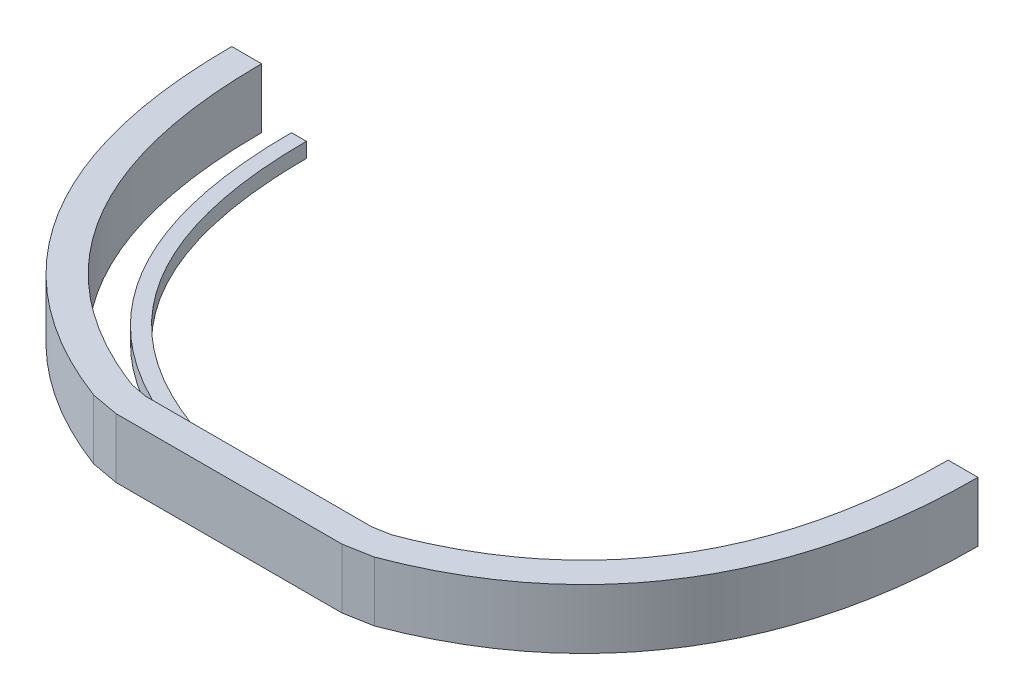
from build123d import *

# Parameters (mm, degrees)
BOSS_EXTRUDE1_DEPTH      = 20
BOSS_EXTRUDE1_DEPTH_BACK = 0.0001
BOSS_EXTRUDE4_DEPTH      = 5


with BuildPart() as part:
    # Sketch4 → Boss-Extrude1 (new, two sides: drawn at the far end of the back side and taken through both)
    with BuildSketch(Plane(origin=(0, 0, -270), x_dir=(-1, 0, 0), z_dir=(0, 1, 0)).offset(-BOSS_EXTRUDE1_DEPTH_BACK)):
        with BuildLine():
            Line((214.999999999, 169.104288462), (224.999999998, 169.104426842))
            add(Edge.make_bspline(
                [(224.999999998, 169.104426842), (224.999974919, 170.916710511), (224.954558622, 174.559843352), (224.679415125, 181.694134696), (223.984242287, 190.432612696), (222.567585315, 200.599347711), (219.872146823, 213.732896531), (214.930493855, 229.327021495), (206.321779618, 246.520686701), (195.001697467, 261.848184611), (183.462412341, 272.756450732), (173.138723517, 280.255372373), (164.896207239, 285.260831915), (157.640364085, 288.920961058), (151.627903078, 291.546243443), (148.540096269, 292.764883121), (146.990873849, 293.345633455)],
                knots=[0.497169382, 0.497169382, 0.497169382, 0.497169382, 0.497311211, 0.497453039, 0.497736697, 0.498020354, 0.498304011, 0.498871326, 0.499438641, 0.500005956, 0.500573271, 0.500856928, 0.501140585, 0.501424243, 0.501566072, 0.5017079, 0.5017079, 0.5017079, 0.5017079], degree=3))
            Line((146.990873849, 293.345633455), (137.864531116, 295))
            Line((137.864531116, 295), (62.135468884, 295))
            Line((62.135468884, 295), (53.009126151, 293.345633455))
            add(Edge.make_bspline(
                [(-24.999999998, 169.104426842), (-24.999974919, 170.916710511), (-24.954558622, 174.559843352), (-24.679415125, 181.694134696), (-23.984242287, 190.432612696), (-22.567585315, 200.599347711), (-19.872146823, 213.732896532), (-14.930493855, 229.327021495), (-6.321779618, 246.520686701), (4.998302533, 261.848184611), (16.537587659, 272.756450732), (26.861276483, 280.255372373), (35.103792761, 285.260831915), (42.359635915, 288.920961058), (48.372096922, 291.546243443), (51.459903731, 292.764883121), (53.009126151, 293.345633455)],
                knots=[0.497169382, 0.497169382, 0.497169382, 0.497169382, 0.497311211, 0.497453039, 0.497736697, 0.498020354, 0.498304011, 0.498871326, 0.499438641, 0.500005956, 0.500573271, 0.500856928, 0.501140585, 0.501424243, 0.501566072, 0.5017079, 0.5017079, 0.5017079, 0.5017079], degree=3))
            Line((-24.999999998, 169.104426842), (-14.999999999, 169.104288463))
            add(Edge.make_bspline(
                [(-14.999999999, 169.104288463), (-14.999976092, 170.831876653), (-14.956619117, 174.308325029), (-14.694962406, 181.087759886), (-14.036476763, 189.356701351), (-12.703754537, 198.913675954), (-10.18542805, 211.177227162), (-5.611430736, 225.58666158), (2.256873954, 241.285209093), (12.524312246, 255.182625466), (22.98750085, 265.077162111), (32.399784152, 271.915566951), (39.951269813, 276.502541648), (46.639369527, 279.877182217), (52.20644523, 282.308299711), (55.079506444, 283.442214827), (56.519257971, 283.98192828)],
                knots=[0.497169382, 0.497169382, 0.497169382, 0.497169382, 0.497311211, 0.497453039, 0.497736697, 0.498020354, 0.498304011, 0.498871326, 0.499438641, 0.500005956, 0.500573271, 0.500856928, 0.501140585, 0.501424243, 0.501566072, 0.5017079, 0.5017079, 0.5017079, 0.5017079], degree=3))
            Line((56.519257971, 283.98192828), (62.135468884, 285))
            Line((62.135468884, 285), (137.864531116, 285))
            Line((137.864531116, 285), (143.480742029, 283.98192828))
            add(Edge.make_bspline(
                [(214.999999999, 169.104288462), (214.999976092, 170.831876653), (214.956619117, 174.308325029), (214.694962406, 181.087759886), (214.036476763, 189.356701351), (212.703754537, 198.913675954), (210.18542805, 211.177227162), (205.611430736, 225.58666158), (197.743126046, 241.285209093), (187.475687754, 255.182625466), (177.01249915, 265.077162111), (167.600215848, 271.915566951), (160.048730187, 276.502541648), (153.360630473, 279.877182217), (147.79355477, 282.308299711), (144.920493556, 283.442214827), (143.480742029, 283.98192828)],
                knots=[0.497169382, 0.497169382, 0.497169382, 0.497169382, 0.497311211, 0.497453039, 0.497736697, 0.498020354, 0.498304011, 0.498871326, 0.499438641, 0.500005956, 0.500573271, 0.500856928, 0.501140585, 0.501424243, 0.501566072, 0.5017079, 0.5017079, 0.5017079, 0.5017079], degree=3))
        make_face()
    extrude(amount=BOSS_EXTRUDE1_DEPTH + BOSS_EXTRUDE1_DEPTH_BACK)


with BuildPart() as body_2:
    # Sketch4<11> → Boss-Extrude4 (new body)
    with BuildSketch(Plane(origin=(0, 0, -270), x_dir=(-1, 0, 0), z_dir=(0, 1, 0))):
        with BuildLine():
            Line((139.970610208, 274.618223105), (137.864531116, 275))
            Line((137.864531116, 275), (62.135468884, 275))
            Line((62.135468884, 275), (60.029389792, 274.618223105))
            add(Edge.make_bspline(
                [(-4.999999999, 169.104150083), (-4.999977265, 170.747042795), (-4.958679611, 174.056806706), (-4.710509687, 180.481385077), (-4.08871124, 188.280790006), (-2.83992376, 197.228004196), (-0.498709277, 208.621557793), (3.707632382, 221.846301666), (10.835527526, 236.049731485), (20.050321959, 248.517066321), (29.437414042, 257.39787349), (37.938291821, 263.575761528), (44.798746865, 267.74425138), (50.919103139, 270.833403376), (56.040793539, 273.07035598), (58.699109157, 274.119546534), (60.029389792, 274.618223105)],
                knots=[0.497169382, 0.497169382, 0.497169382, 0.497169382, 0.497311211, 0.497453039, 0.497736697, 0.498020354, 0.498304011, 0.498871326, 0.499438641, 0.500005956, 0.500573271, 0.500856928, 0.501140585, 0.501424243, 0.501566072, 0.5017079, 0.5017079, 0.5017079, 0.5017079], degree=3))
            Line((-4.999999999, 169.104150083), (0, 169.104080894))
            add(Edge.make_bspline(
                [(0, 169.104080894), (0.001074817, 246.775900688), (61.784455702, 269.936370518)],
                knots=[0, 0, 0, 1, 1, 1], degree=2))
            Line((61.784455702, 269.936370518), (62.135468884, 270))
            Line((62.135468884, 270), (137.864531116, 270))
            Line((137.864531116, 270), (138.215544298, 269.936370518))
            add(Edge.make_bspline(
                [(200, 169.104080894), (199.998925183, 246.775900688), (138.215544298, 269.936370518)],
                knots=[0, 0, 0, 1, 1, 1], degree=2))
            Line((200, 169.104080894), (205, 169.104150083))
            add(Edge.make_bspline(
                [(205, 169.104150083), (204.999977265, 170.747042795), (204.958679611, 174.056806706), (204.710509687, 180.481385077), (204.08871124, 188.280790006), (202.83992376, 197.228004196), (200.498709277, 208.621557793), (196.292367618, 221.846301666), (189.164472474, 236.049731485), (179.949678041, 248.517066321), (170.562585958, 257.39787349), (162.061708179, 263.575761528), (155.201253135, 267.74425138), (149.080896861, 270.833403376), (143.959206461, 273.07035598), (141.300890843, 274.119546534), (139.970610208, 274.618223105)],
                knots=[0.497169382, 0.497169382, 0.497169382, 0.497169382, 0.497311211, 0.497453039, 0.497736697, 0.498020354, 0.498304011, 0.498871326, 0.499438641, 0.500005956, 0.500573271, 0.500856928, 0.501140585, 0.501424243, 0.501566072, 0.5017079, 0.5017079, 0.5017079, 0.5017079], degree=3))
        make_face()
    extrude(amount=BOSS_EXTRUDE4_DEPTH)


solid = Compound([part.part, body_2.part])
